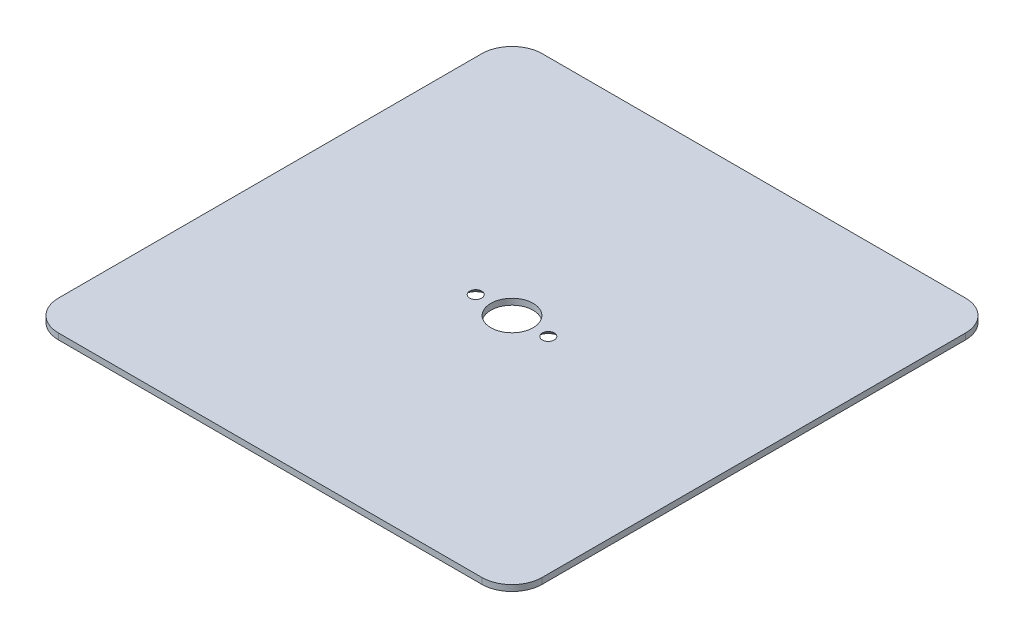
from build123d import *

# Parameters (mm, degrees)
ESQUISSE1_W                  = 80
ESQUISSE1_H                  = 80
EXTRUSION1_DEPTH             = 1
CONG_1_R                     = 5
ESQUISSE2_R                  = 3.5
ENL_V_MAT_EXTRU_1_DEPTH      = 114.141504321
ESQUISSE3_R                  = 1
ENL_V_MAT_EXTRU_2_DEPTH      = 114.141504321
R_P_TITION_CIRCULAIRE1_COUNT = 2
CHANFREIN1_SIZE              = 1


with BuildPart() as part:
    # Esquisse1 → Extrusion1 (new body)
    with BuildSketch(Plane(origin=(0, 0, 0), x_dir=(1, 0, 0), z_dir=(0, 1, 0))):
        with Locations((40, 40)):
            Rectangle(ESQUISSE1_W, ESQUISSE1_H)
    extrude(amount=EXTRUSION1_DEPTH)

    # Congé1
    cong_1_edges = [part.edges().sort_by_distance(p)[0] for p in [
        (0, 0.5, -80),
        (80, 0.5, -80),
        (80, 0.5, 0),
        (0, 0.5, 0),
    ]]
    fillet(cong_1_edges, radius=CONG_1_R)

    # Esquisse2 → Enlèv. mat.-Extru.1 (cut, through all)
    with BuildSketch(Plane.XZ):
        with Locations(Location((40, -40, 0), (0, 0, 270))):
            Circle(ESQUISSE2_R)
    extrude(amount=-ENL_V_MAT_EXTRU_1_DEPTH, mode=Mode.SUBTRACT)

    # Esquisse3 → Enlèv. mat.-Extru.2 (cut, through all)
    with BuildSketch(Plane(origin=(0, 1, 0), x_dir=(1, 0, 0), z_dir=(0, 1, 0))):
        with Locations(Location((34, 40, 0), (0, 0, 270))):
            Circle(ESQUISSE3_R)
    enl_v_mat_extru_2 = extrude(amount=-ENL_V_MAT_EXTRU_2_DEPTH, mode=Mode.SUBTRACT)

    # Répétition circulaire1: Enlèv. mat.-Extru.2 ×2 about axis
    r_p_tition_circulaire1_axis = Axis((40, 0, -40), (0, 1, 0))
    for i in range(1, R_P_TITION_CIRCULAIRE1_COUNT):
        add(enl_v_mat_extru_2.rotate(r_p_tition_circulaire1_axis, i * 360 / R_P_TITION_CIRCULAIRE1_COUNT), mode=Mode.SUBTRACT)

    # Chanfrein1
    chanfrein1_edges = [part.edges().sort_by_distance(p)[0] for p in [
        (34, 0, -41),
        (46, 0, -39),
    ]]
    chamfer(chanfrein1_edges, length=CHANFREIN1_SIZE - 0.0001)  # a hair under: the kernel refuses the full size


solid = part.part
